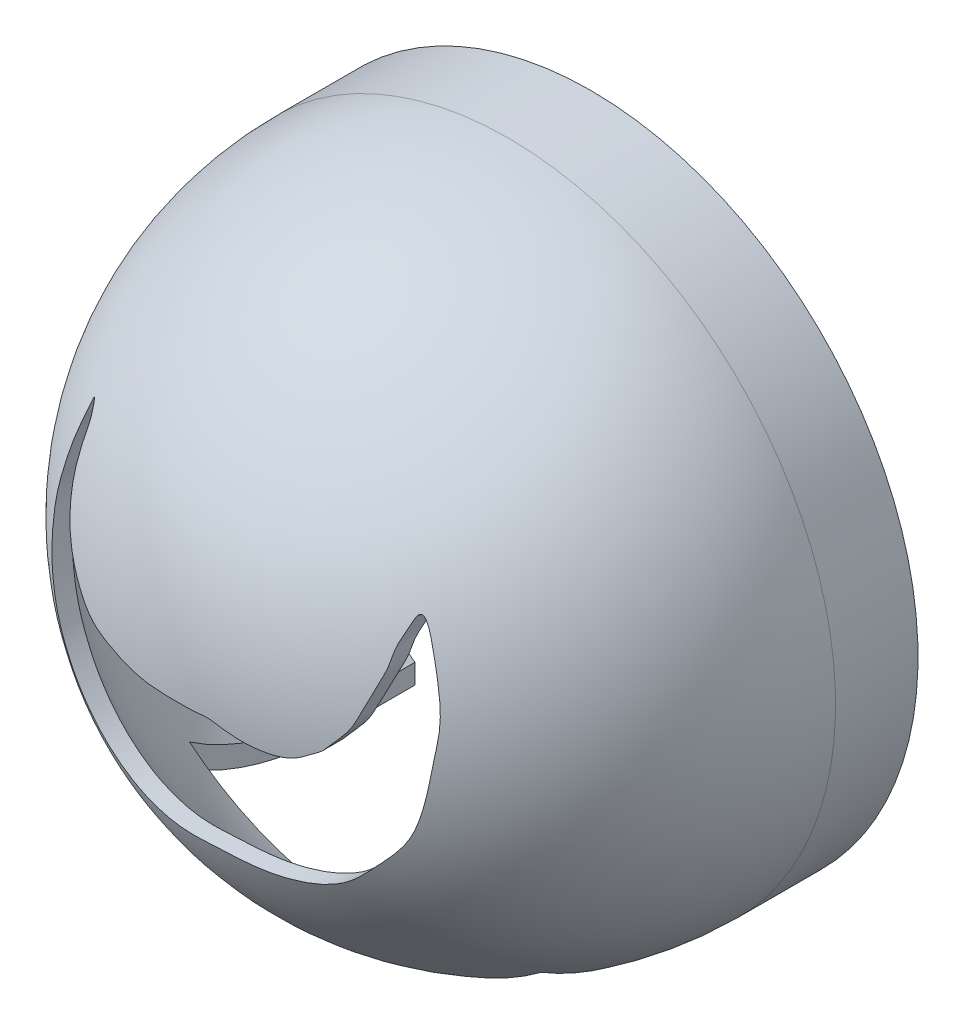
from build123d import *

# Parameters (mm, degrees)
SHELL1_T           = 3
CUT_EXTRUDE1_DEPTH = 170.883652636
SKETCH4_W          = 64
SKETCH4_H          = 41
CUT_EXTRUDE2_DEPTH = 170.883652636


with BuildPart() as part:
    # Sketch2 → Revolve1 (revolve)
    with BuildSketch(Plane(origin=(0, 0, 0), x_dir=(0, 0, -1), z_dir=(1, 0, 0))):
        with BuildLine():
            Line((76.080335522, 0), (147.580335522, 0))
            Line((147.580335522, 0), (147.580335522, 56.5))
            Line((147.580335522, 56.5), (132.580335522, 56.5))
            ThreePointArc((132.580335522, 56.5), (92.628802385, 39.951533137), (76.080335522, 0))
        make_face()
    revolve(axis=Axis((0, 0, -76.080335522), (0, 0, 1)))

    # Shell1
    shell1_openings = [part.faces().sort_by_distance(p)[0] for p in [
        (0, 0, -147.580335522),
    ]]
    offset(amount=SHELL1_T, openings=shell1_openings, kind=Kind.INTERSECTION)

    # Sketch3 → Cut-Extrude1 (cut, through all)
    with BuildSketch(Plane.XY):
        with BuildLine():
            add(Edge.make_bspline(
                [(29.522891756, 21.497805361), (29.152797273, 20.047405567), (28.445798811, 18.509158877), (28.357031311, 15.551451628), (27.373897718, 12.263878367), (26.277902233, 9.002410314), (24.868008759, 5.166506053), (23.039248699, 3.32415804), (21.649487378, 1.389955893), (20.050715814, 0.488070774), (18.401573818, -0.764646703), (15.775816116, -1.554321913), (13.081673285, -1.522619738), (9.867652918, -1.214511696), (7.153763288, -0.4984241), (4.47827286, 0.266851808), (2.401086118, 0.03366943), (-0.224679919, 0.108879459), (-4.063198031, -0.069556645), (-7.772874694, -0.082216152), (-11.377299512, 0.349900802), (-15.005170627, 0.953649258), (-19.632647727, 1.436989605), (-23.993909736, 4.498676409), (-28.246814683, 8.696893455), (-30.653619174, 14.963802224), (-30.273962974, 20.317640894), (-30.14939015, 23.475202342), (-31.355105734, 25.581990616), (-31.585851965, 24.38132713), (-32.116188317, 22.256751203), (-33.294384764, 18.771725164), (-34.038877936, 14.388684191), (-34.890942526, 10.44414779), (-35.047573017, 7.322086834), (-34.892893172, 3.619549803), (-34.473377934, -2.240041987), (-33.137423099, -8.793535996), (-26.91107187, -16.687269338), (-20.857004986, -21.836014499), (-13.308554631, -24.832161822), (-5.691831651, -25.570630546), (1.119687989, -24.18923609), (10.266585174, -25.019388155), (20.265652316, -23.634933014), (26.693618169, -16.438215303), (31.442699681, -11.569901895), (33.993269413, -3.848982446), (34.646742284, 2.509288088), (35.192131707, 7.716881006), (34.368424724, 14.213834169), (30.305851744, 24.687894703), (29.57500266, 21.703394871), (29.5276449, 21.516432928), (29.522891756, 21.497805361)],
                knots=[0, 0, 0, 0, 0.018271917, 0.027173698, 0.035830505, 0.061860902, 0.070881353, 0.087060173, 0.094196142, 0.100654685, 0.109984187, 0.120337333, 0.134591365, 0.143877236, 0.16116311, 0.170164928, 0.178714092, 0.187249478, 0.20372696, 0.225194157, 0.236365422, 0.249273952, 0.272052213, 0.293931943, 0.315061317, 0.347273105, 0.375459685, 0.380217762, 0.390050808, 0.393573352, 0.398558611, 0.416613656, 0.441034994, 0.454400452, 0.467621641, 0.480753968, 0.501005163, 0.540880663, 0.574790416, 0.610261549, 0.64450849, 0.675424809, 0.704128267, 0.732237338, 0.792285905, 0.820872162, 0.851803445, 0.87932486, 0.914057306, 0.933556286, 0.963051966, 0.997653327, 0.999765333, 1, 1, 1, 1], degree=3))
        make_face()
    extrude(amount=-CUT_EXTRUDE1_DEPTH, mode=Mode.SUBTRACT)

    # Sketch4 → Cut-Extrude2 (cut, through all)
    with BuildSketch(Plane(origin=(0, 0, 0), x_dir=(1, 0, 0), z_dir=(0, 1, 0))):
        with Locations((0, 127.080335522)):
            Rectangle(SKETCH4_W, SKETCH4_H)
    extrude(amount=-CUT_EXTRUDE2_DEPTH, mode=Mode.SUBTRACT)


solid = part.part
